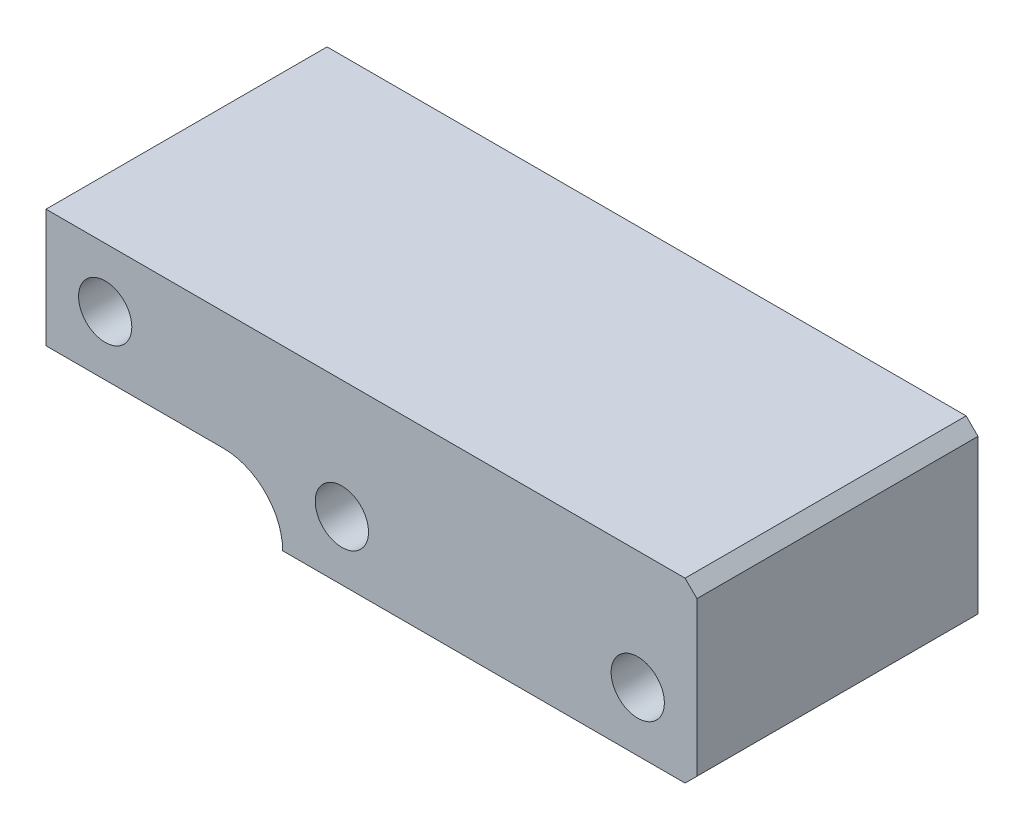
from build123d import *

# Parameters (mm, degrees)
SKETCH_1_R      = 4.5
EXTRUDE_1_DEPTH = 47.5
FILLET_1_R      = 10
CHAMFER_1_SIZE  = 2


with BuildPart() as part:
    # 草图1 → 凸台-拉伸1 (new body)
    with BuildSketch(Plane.XY):
        Polygon((-35, 0), (-35, -10), (35, -10), (35, 10), (35, 20), (-35, 20), (-65, 20), (-75, 20), (-75, 0), align=None)
        with Locations((-25, 0)):
            Circle(SKETCH_1_R, mode=Mode.SUBTRACT)
        with Locations((25, 0)):
            Circle(SKETCH_1_R, mode=Mode.SUBTRACT)
        with Locations((-65, 10)):
            Circle(SKETCH_1_R, mode=Mode.SUBTRACT)
    extrude(amount=EXTRUDE_1_DEPTH)

    # 圆角1
    fillet_1_edges = [part.edges().sort_by_distance(p)[0] for p in [
        (-35, 0, 23.75),
    ]]
    fillet(fillet_1_edges, radius=FILLET_1_R - 0.0001)  # a hair under: the kernel refuses the full size

    # 倒角1
    chamfer_1_edges = [part.edges().sort_by_distance(p)[0] for p in [
        (35, -10, 23.75),
        (35, 20, 23.75),
    ]]
    chamfer(chamfer_1_edges, length=CHAMFER_1_SIZE)


solid = part.part
